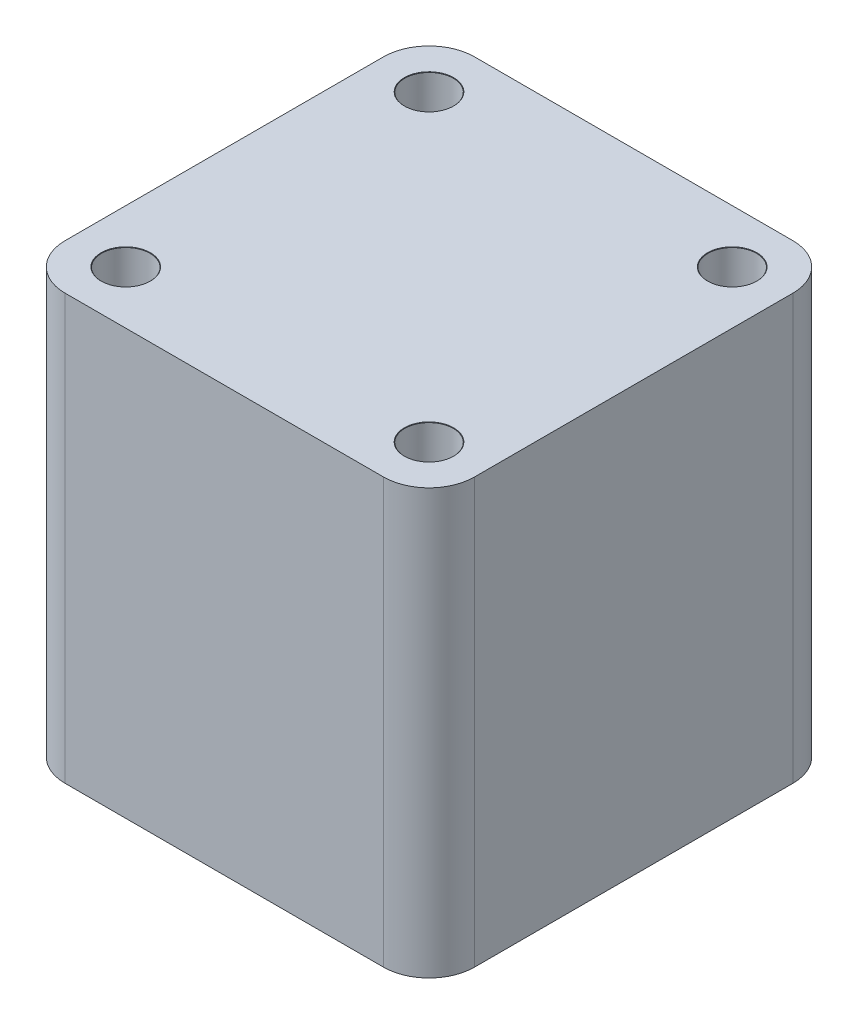
from build123d import *

# Parameters (mm, degrees)
SKETCH1_W                     = 27
SKETCH1_H                     = 27
BOSS_EXTRUDE1_DEPTH           = 28
M3_CLEARANCE_HOLE1_AT_2_COUNT = 2
M3_CLEARANCE_HOLE1_AT_2_PITCH = 20
M3_CLEARANCE_HOLE1_AT_3_COUNT = 2
M3_CLEARANCE_HOLE1_AT_3_PITCH = 28.284271247
M3_CLEARANCE_HOLE1_AT_4_COUNT = 2
M3_CLEARANCE_HOLE1_AT_4_PITCH = 20
FILLET1_R                     = 3


with BuildPart() as part:
    # Sketch1 → Boss-Extrude1 (new body)
    with BuildSketch(Plane(origin=(0, 0, 0), x_dir=(1, 0, 0), z_dir=(0, 1, 0))):
        Rectangle(SKETCH1_W, SKETCH1_H)
    extrude(amount=BOSS_EXTRUDE1_DEPTH)

    # Sketch4 → M3 Clearance Hole1 (revolve, cut)
    with BuildSketch(Plane(origin=(10, 0, -10), x_dir=(0, 0, -1), z_dir=(1, 0, 0))):
        Polygon((0, 0), (0, 28), (1.625, 28), (1.6, 27.975), (1.6, 0.025), (1.625, 0), align=None)
    m3_clearance_hole1 = revolve(axis=Axis((10, -6.35, -10), (0, 1, 0)), mode=Mode.SUBTRACT)

    # M3 Clearance Hole1 at 2: M3 Clearance Hole1 ×2
    with Locations(*[(-i * M3_CLEARANCE_HOLE1_AT_2_PITCH, 0, 0) for i in range(1, M3_CLEARANCE_HOLE1_AT_2_COUNT)]):
        add(m3_clearance_hole1, mode=Mode.SUBTRACT)

    # M3 Clearance Hole1 at 3: M3 Clearance Hole1 ×2
    with Locations(*[Vector(-0.7071067811865476, 0, 0.7071067811865475) * (i * M3_CLEARANCE_HOLE1_AT_3_PITCH) for i in range(1, M3_CLEARANCE_HOLE1_AT_3_COUNT)]):
        add(m3_clearance_hole1, mode=Mode.SUBTRACT)

    # M3 Clearance Hole1 at 4: M3 Clearance Hole1 ×2
    with Locations(*[(0, 0, i * M3_CLEARANCE_HOLE1_AT_4_PITCH) for i in range(1, M3_CLEARANCE_HOLE1_AT_4_COUNT)]):
        add(m3_clearance_hole1, mode=Mode.SUBTRACT)

    # Fillet1
    fillet1_edges = [part.edges().sort_by_distance(p)[0] for p in [
        (13.5, 14, 13.5),
        (-13.5, 14, 13.5),
        (13.5, 14, -13.5),
        (-13.5, 14, -13.5),
    ]]
    fillet(fillet1_edges, radius=FILLET1_R)


solid = part.part
